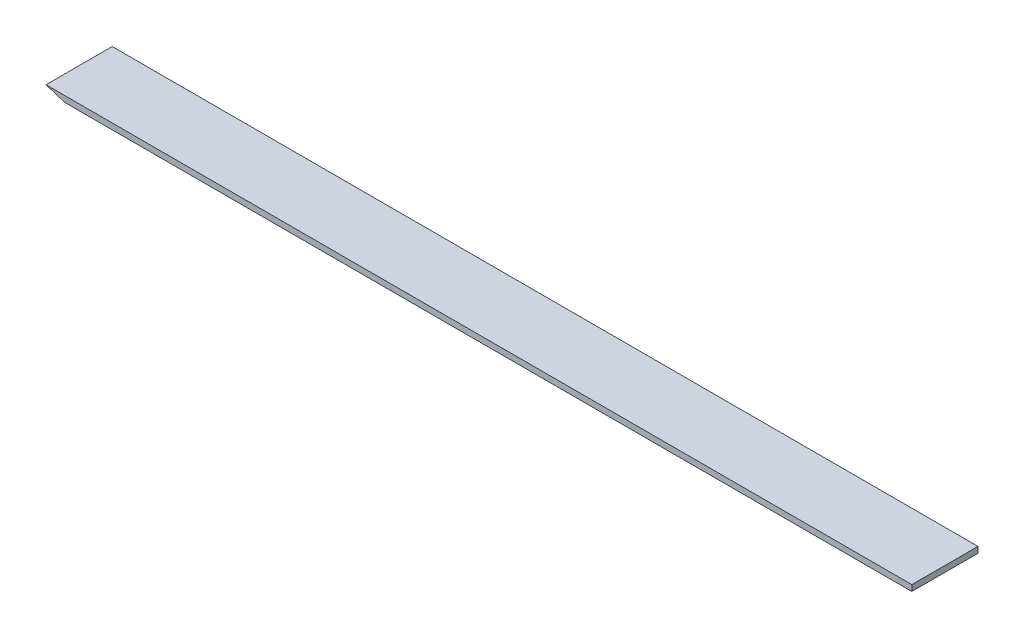
from build123d import *

# Parameters (mm, degrees)
BOSS_EXTRUDE1_DEPTH = 100


with BuildPart() as part:
    # Sketch1 → Boss-Extrude1 (new body)
    with BuildSketch(Plane.XY):
        Polygon((0, 0), (1308, 0), (1308, -9), (28, -9), align=None)
    extrude(amount=BOSS_EXTRUDE1_DEPTH)


solid = part.part
